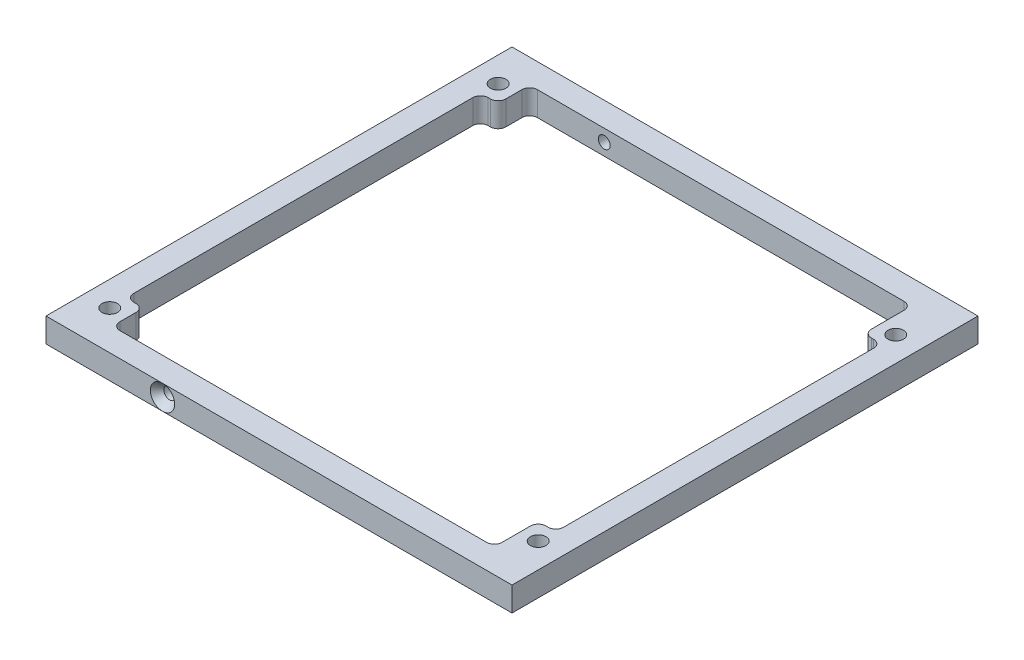
from build123d import *

# Parameters (mm, degrees)
SKETCH1_W                                         = 96
SKETCH1_H                                         = 96
BOSS_EXTRUDE1_DEPTH                               = 5
CUT_EXTRUDE10_DEPTH                               = 92
CUT_EXTRUDE10_DEPTH_BACK                          = 6
SKETCH47_R                                        = 0.8255
SKETCH66_R                                        = 1.6
CUT_EXTRUDE11_DEPTH                               = 10
CSK_FOR_2_FLAT_HEAD_SOCKET_CAP_SCREW1_D           = 2.4384
CSK_FOR_2_FLAT_HEAD_SOCKET_CAP_SCREW1_DEPTH       = 32
CSK_FOR_2_FLAT_HEAD_SOCKET_CAP_SCREW1_CSINK_D     = 5.0038
CSK_FOR_2_FLAT_HEAD_SOCKET_CAP_SCREW1_CSINK_ANGLE = 82
CSK_FOR_2_FLAT_HEAD_SOCKET_CAP_SCREW1_TIP         = 0.732569267
CSK_FOR_2_FLAT_HEAD_SOCKET_CAP_SCREW2_D           = 2.4384
CSK_FOR_2_FLAT_HEAD_SOCKET_CAP_SCREW2_DEPTH       = 32
CSK_FOR_2_FLAT_HEAD_SOCKET_CAP_SCREW2_CSINK_D     = 5.0038
CSK_FOR_2_FLAT_HEAD_SOCKET_CAP_SCREW2_CSINK_ANGLE = 82
CSK_FOR_2_FLAT_HEAD_SOCKET_CAP_SCREW2_TIP         = 0.732569267
TAP_DRILL_FOR_0_80_TAP7_D                         = 1.19126
TAP_DRILL_FOR_0_80_TAP7_DEPTH                     = 3
TAP_DRILL_FOR_0_80_TAP7_TIP                       = 0.357890611


with BuildPart() as part:
    # Sketch1 → Boss-Extrude1 (new body)
    with BuildSketch(Plane(origin=(0, 0, 0), x_dir=(1, 0, 0), z_dir=(0, 1, 0))):
        Rectangle(SKETCH1_W, SKETCH1_H)
        Polygon((-21.5, -43), (33, -43), (33, -23), (43, -23), (43, 23), (33, 23), (33, 43), (-21.5, 43), (-26.5, 43), (-31.5, 43), (-35.5, 43), (-35.5, 28), (-43, 28), (-43, -28), (-35.5, -28), (-35.5, -43), (-31.5, -43), (-26.5, -43), align=None, mode=Mode.SUBTRACT)
    extrude(amount=BOSS_EXTRUDE1_DEPTH)

    # Sketch47 → Cut-Extrude10 (cut, two sides: drawn at the far end of the back side and taken through both)
    with BuildSketch(Plane.XY.offset(-43).offset(-CUT_EXTRUDE10_DEPTH_BACK)):
        with Locations((-24, 2.5)):
            Circle(SKETCH47_R)
    extrude(amount=CUT_EXTRUDE10_DEPTH + CUT_EXTRUDE10_DEPTH_BACK, mode=Mode.SUBTRACT)

    # Sketch66 → Cut-Extrude11 (cut)
    with BuildSketch(Plane(origin=(0, 5, 0), x_dir=(1, 0, 0), z_dir=(0, 1, 0))):
        with Locations((-42.8625, 40.005)):
            Circle(SKETCH66_R)
        with Locations((42.8625, 36.195)):
            Circle(SKETCH66_R)
        with Locations((42.8625, -37.465)):
            Circle(SKETCH66_R)
        with Locations((-42.8625, -40.005)):
            Circle(SKETCH66_R)
        with BuildLine():
            Line((43, -23), (43, -32.3775))
            ThreePointArc((43, -32.3775), (42.535032015, -33.500032015), (41.4125, -33.965))
            Line((41.4125, -33.965), (40.95, -33.965))
            ThreePointArc((40.95, -33.965), (39.827467985, -34.429967985), (39.3625, -35.5525))
            Line((39.3625, -35.5525), (39.3625, -41.4125))
            ThreePointArc((39.3625, -41.4125), (38.897532015, -42.535032015), (37.775, -43))
            Line((37.775, -43), (33, -43))
            Line((33, -43), (33, -23))
            Line((33, -23), (43, -23))
        make_face()
        with BuildLine():
            Line((43, 23), (33, 23))
            Line((33, 23), (33, 43))
            Line((33, 43), (37.775, 43))
            ThreePointArc((37.775, 43), (38.897532015, 42.535032015), (39.3625, 41.4125))
            Line((39.3625, 41.4125), (39.3625, 34.675))
            ThreePointArc((39.3625, 34.675), (39.827467985, 33.552467985), (40.95, 33.0875))
            Line((40.95, 33.0875), (41.4125, 33.0875))
            ThreePointArc((41.4125, 33.0875), (42.535032015, 32.622532015), (43, 31.5))
            Line((43, 31.5), (43, 23))
        make_face()
        with BuildLine():
            Line((-43, 28), (-43, 34.9175))
            ThreePointArc((-43, 34.9175), (-42.535032015, 36.040032015), (-41.4125, 36.505))
            Line((-41.4125, 36.505), (-40.95, 36.505))
            ThreePointArc((-40.95, 36.505), (-39.827467985, 36.969967985), (-39.3625, 38.0925))
            Line((-39.3625, 38.0925), (-39.3625, 41.4125))
            ThreePointArc((-39.3625, 41.4125), (-38.897532015, 42.535032015), (-37.775, 43))
            Line((-37.775, 43), (-35.5, 43))
            Line((-35.5, 43), (-35.5, 28))
            Line((-35.5, 28), (-43, 28))
        make_face()
        with BuildLine():
            Line((-35.5, -43), (-35.5, -28))
            Line((-35.5, -28), (-43, -28))
            Line((-43, -28), (-43, -34.9175))
            ThreePointArc((-43, -34.9175), (-42.535032015, -36.040032015), (-41.4125, -36.505))
            Line((-41.4125, -36.505), (-40.95, -36.505))
            ThreePointArc((-40.95, -36.505), (-39.827467985, -36.969967985), (-39.3625, -38.0925))
            Line((-39.3625, -38.0925), (-39.3625, -41.4125))
            ThreePointArc((-39.3625, -41.4125), (-38.897532015, -42.535032015), (-37.775, -43))
            Line((-37.775, -43), (-35.5, -43))
        make_face()
    extrude(amount=-CUT_EXTRUDE11_DEPTH, mode=Mode.SUBTRACT)

    # CSK for #2 Flat Head Socket Cap Screw1
    with Locations(Plane.XY.offset(48)):
        with Locations((-24, 2.5)):
            CounterSinkHole(CSK_FOR_2_FLAT_HEAD_SOCKET_CAP_SCREW1_D / 2, CSK_FOR_2_FLAT_HEAD_SOCKET_CAP_SCREW1_CSINK_D / 2, depth=CSK_FOR_2_FLAT_HEAD_SOCKET_CAP_SCREW1_DEPTH, counter_sink_angle=CSK_FOR_2_FLAT_HEAD_SOCKET_CAP_SCREW1_CSINK_ANGLE)
            with Locations((0, 0, -(CSK_FOR_2_FLAT_HEAD_SOCKET_CAP_SCREW1_DEPTH + CSK_FOR_2_FLAT_HEAD_SOCKET_CAP_SCREW1_TIP / 2))):  # 118° drill point
                Cone(0, CSK_FOR_2_FLAT_HEAD_SOCKET_CAP_SCREW1_D / 2, CSK_FOR_2_FLAT_HEAD_SOCKET_CAP_SCREW1_TIP, mode=Mode.SUBTRACT)

    # CSK for #2 Flat Head Socket Cap Screw2
    with Locations(Plane(origin=(0, 0, -48), x_dir=(-1, 0, 0), z_dir=(0, 0, -1))):
        with Locations((24, 2.5)):
            CounterSinkHole(CSK_FOR_2_FLAT_HEAD_SOCKET_CAP_SCREW2_D / 2, CSK_FOR_2_FLAT_HEAD_SOCKET_CAP_SCREW2_CSINK_D / 2, depth=CSK_FOR_2_FLAT_HEAD_SOCKET_CAP_SCREW2_DEPTH, counter_sink_angle=CSK_FOR_2_FLAT_HEAD_SOCKET_CAP_SCREW2_CSINK_ANGLE)
            with Locations((0, 0, -(CSK_FOR_2_FLAT_HEAD_SOCKET_CAP_SCREW2_DEPTH + CSK_FOR_2_FLAT_HEAD_SOCKET_CAP_SCREW2_TIP / 2))):  # 118° drill point
                Cone(0, CSK_FOR_2_FLAT_HEAD_SOCKET_CAP_SCREW2_D / 2, CSK_FOR_2_FLAT_HEAD_SOCKET_CAP_SCREW2_TIP, mode=Mode.SUBTRACT)

    # Tap Drill for #0-80 Tap7
    with Locations(Plane(origin=(0, 0, 0), x_dir=(-1, 0, 0), z_dir=(0, -1, 0))):
        with Locations((13, -45.5), (-37, -45.5), (-37, 45.5), (13, 45.5)):
            Hole(TAP_DRILL_FOR_0_80_TAP7_D / 2, depth=TAP_DRILL_FOR_0_80_TAP7_DEPTH)
            with Locations((0, 0, -(TAP_DRILL_FOR_0_80_TAP7_DEPTH + TAP_DRILL_FOR_0_80_TAP7_TIP / 2))):  # 118° drill point
                Cone(0, TAP_DRILL_FOR_0_80_TAP7_D / 2, TAP_DRILL_FOR_0_80_TAP7_TIP, mode=Mode.SUBTRACT)


solid = part.part
